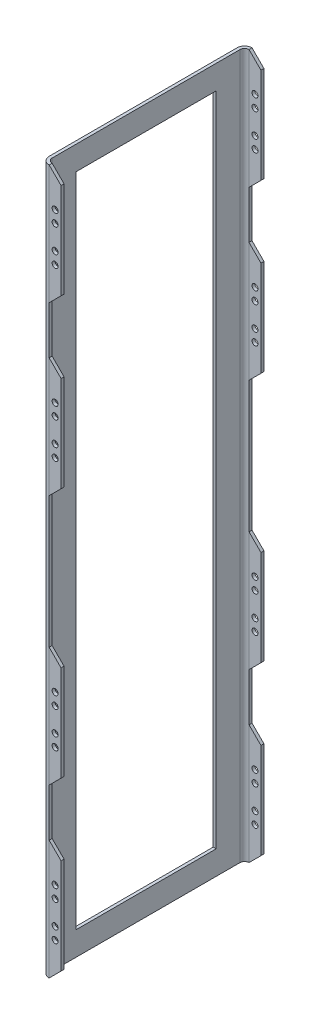
from build123d import *

# Parameters (mm, degrees)
MAINPLATEEXTRUDE_DEPTH = 374.65
FLANGECUT_DEPTH        = 107.95
SKETCH3_W              = 74.5998
SKETCH3_H              = 349.25
CUT_EXTRUDE2_DEPTH     = 1.5875
SKETCH4_R              = 1.5875
CUT_EXTRUDE3_DEPTH     = 127


with BuildPart() as part:
    # Sketch1 → MainPlateExtrude (new body)
    with BuildSketch(Plane(origin=(0, 0, 0), x_dir=(1, 0, 0), z_dir=(0, 1, 0))):
        with BuildLine():
            Line((-49.9999, -49.9999), (-49.9999, 49.9999))
            ThreePointArc((-49.9999, 49.9999), (-49.302448023, 51.683698023), (-47.61865, 52.38115))
            Line((-47.61865, 52.38115), (-41.26865, 52.38115))
            Line((-41.26865, 52.38115), (-41.26865, 53.96865))
            Line((-41.26865, 53.96865), (-47.61865, 53.96865))
            ThreePointArc((-47.61865, 53.96865), (-50.424980038, 52.806230038), (-51.5874, 49.9999))
            Line((-51.5874, 49.9999), (-51.5874, -49.9999))
            ThreePointArc((-51.5874, -49.9999), (-50.424980038, -52.806230038), (-47.61865, -53.96865))
            Line((-47.61865, -53.96865), (-41.26865, -53.96865))
            Line((-41.26865, -53.96865), (-41.26865, -52.38115))
            Line((-41.26865, -52.38115), (-47.61865, -52.38115))
            ThreePointArc((-47.61865, -52.38115), (-49.302448023, -51.683698023), (-49.9999, -49.9999))
        make_face()
    extrude(amount=MAINPLATEEXTRUDE_DEPTH)

    # Sketch2 → FlangeCut (cut)
    with BuildSketch(Plane.XY.offset(53.96865)):
        Polygon((-41.26865, 374.65), (-47.61865, 374.65), (-41.26865, 368.3), align=None)
        Polygon((-41.26865, 317.5), (-47.61865, 311.15), (-47.61865, 285.75), (-41.26865, 279.4), align=None)
        Polygon((-41.26865, 228.6), (-47.61865, 222.25), (-47.61865, 152.4), (-41.26865, 146.05), align=None)
        Polygon((-41.26865, 95.25), (-47.61865, 88.9), (-47.61865, 63.5), (-41.26865, 57.15), align=None)
        Polygon((-41.26865, 6.35), (-47.61865, 0), (-41.26865, 0), align=None)
    extrude(amount=-FLANGECUT_DEPTH, mode=Mode.SUBTRACT)

    # Sketch3 → Cut-Extrude2 (cut)
    with BuildSketch(Plane.ZY.offset(51.5874)):
        with Locations((0, 187.325)):
            Rectangle(SKETCH3_W, SKETCH3_H)
    extrude(amount=-CUT_EXTRUDE2_DEPTH, mode=Mode.SUBTRACT)

    # Sketch4 → Cut-Extrude3 (cut)
    with BuildSketch(Plane(origin=(0, 0, -53.96865), x_dir=(-1, 0, 0), z_dir=(0, 0, -1))):
        with Locations((44.44365, 38.1)):
            Circle(SKETCH4_R)
        with Locations((44.44365, 25.4)):
            Circle(SKETCH4_R)
        with Locations((44.44365, 44.45)):
            Circle(SKETCH4_R)
        with Locations((44.44365, 19.05)):
            Circle(SKETCH4_R)
        with Locations((44.44365, 114.3)):
            Circle(SKETCH4_R)
        with Locations((44.44365, 127)):
            Circle(SKETCH4_R)
        with Locations((44.44365, 133.35)):
            Circle(SKETCH4_R)
        with Locations((44.44365, 107.95)):
            Circle(SKETCH4_R)
        with Locations((44.44365, 336.55)):
            Circle(SKETCH4_R)
        with Locations((44.44365, 260.35)):
            Circle(SKETCH4_R)
        with Locations((44.44365, 349.25)):
            Circle(SKETCH4_R)
        with Locations((44.44365, 241.3)):
            Circle(SKETCH4_R)
        with Locations((44.44365, 355.6)):
            Circle(SKETCH4_R)
        with Locations((44.44365, 266.7)):
            Circle(SKETCH4_R)
        with Locations((44.44365, 330.2)):
            Circle(SKETCH4_R)
        with Locations((44.44365, 247.65)):
            Circle(SKETCH4_R)
    extrude(amount=-CUT_EXTRUDE3_DEPTH, mode=Mode.SUBTRACT)


solid = part.part
